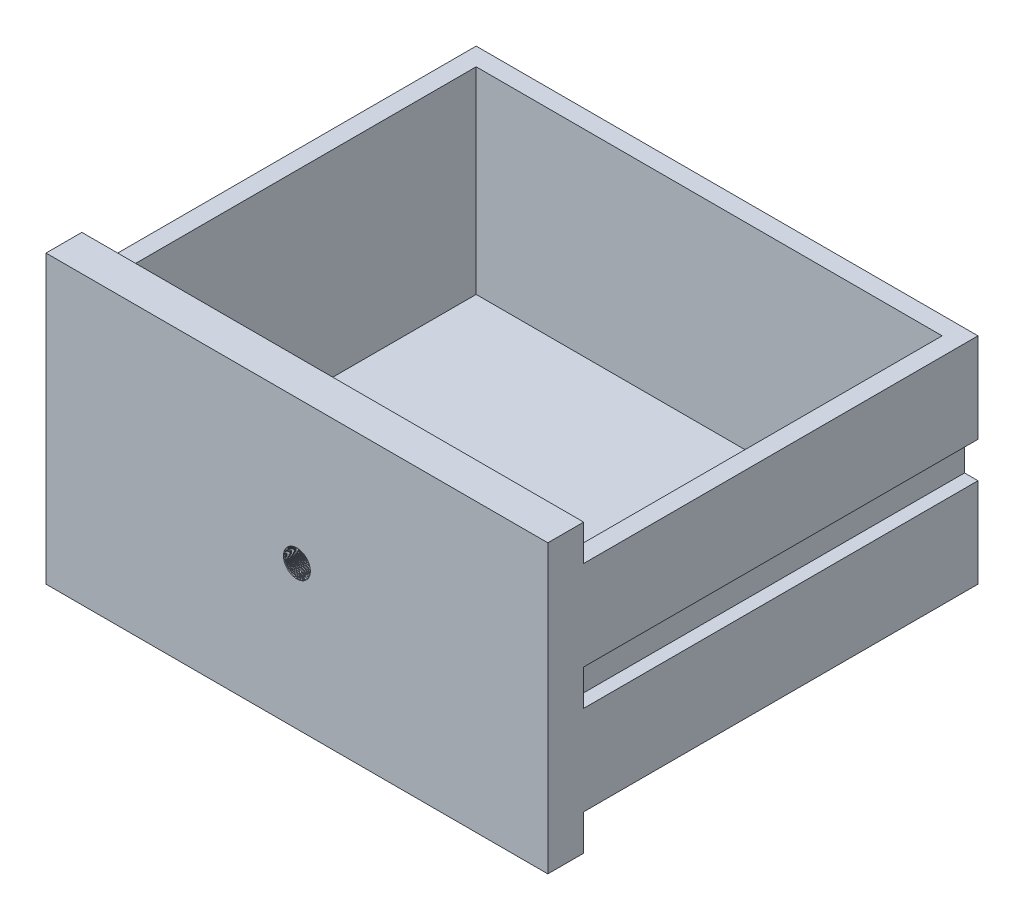
from build123d import *
from build123d.topology import SkipClean

# Parameters (mm, degrees)
SKETCH1_W           = 355.6
SKETCH1_H           = 203.2
BOSS_EXTRUDE1_DEPTH = 25.4
SKETCH2_W           = 355.6
SKETCH2_H           = 152.4
BOSS_EXTRUDE2_DEPTH = 279.4
SHELL1_START        = -63.5
SHELL1_OUTLINE_W    = 330.2
SHELL1_OUTLINE_H    = 279.4
SHELL1_DEPTH        = 139.7
SKETCH3_W           = 19.05
SKETCH3_H           = 25.4
CUT_EXTRUDE1_DEPTH  = 279.4
CUT_EXTRUDE2_REACH  = 369.204
SKETCH4_R           = 9.525
THREAD1_PITCH       = 0.79375
SCALE1_SCALE        = 0.75


# Read off the part's stored shape, not the designer's step: Shell1
with BuildPart() as part:
    # Sketch1 → Boss-Extrude1 (new body)
    with BuildSketch(Plane.XY):
        Rectangle(SKETCH1_W, SKETCH1_H)
    extrude(amount=-BOSS_EXTRUDE1_DEPTH)

    # Sketch2 → Boss-Extrude2 (add)
    with BuildSketch(Plane(origin=(0, 0, -25.4), x_dir=(-1, 0, 0), z_dir=(0, 0, -1))):
        Rectangle(SKETCH2_W, SKETCH2_H)
    extrude(amount=BOSS_EXTRUDE2_DEPTH)

    # Shell1 outline → Shell1 (cut)
    with BuildSketch(Plane(origin=(0, 0, 0), x_dir=(1, 0, 0), z_dir=(0, 1, 0)).offset(SHELL1_START)):
        with Locations((0, 152.4)):
            Rectangle(SHELL1_OUTLINE_W, SHELL1_OUTLINE_H)
    extrude(amount=SHELL1_DEPTH, mode=Mode.SUBTRACT)

    # Sketch3 → Cut-Extrude1 (cut)
    with BuildSketch(Plane(origin=(0, 0, -304.8), x_dir=(-1, 0, 0), z_dir=(0, 0, -1))):
        with Locations((-177.8, 0)):
            Rectangle(SKETCH3_W, SKETCH3_H)
        with Locations((177.8, 0)):
            Rectangle(SKETCH3_W, SKETCH3_H)
    extrude(amount=-CUT_EXTRUDE1_DEPTH, mode=Mode.SUBTRACT)

    # Sketch4 → Cut-Extrude2 (cut, up to next)
    with BuildSketch(Plane.XY, mode=Mode.PRIVATE) as cut_extrude2_sk1:
        Circle(SKETCH4_R)
    cut_extrude2_tool1 = extrude(cut_extrude2_sk1.sketch, amount=-CUT_EXTRUDE2_REACH, mode=Mode.PRIVATE) & part.part
    add(cut_extrude2_tool1.solids().sort_by_distance((0, 0, 0))[0], mode=Mode.SUBTRACT)

    # Thread1: the profile of Thread Profile1 profile screwed along a right-hand helix of 32 turns, 8 arcs to a turn; built about Z, then put on its axis
    with SkipClean():  # the faces are left unmerged after this step: merging them gives an invalid solid
        thread1_z = Axis((0, 0, 0), (0, 0, 1))
        thread1_corners = [(9.5253, 0, -0.000173), (9.5253, 0, 0.694704), (9.09537, 0, 0.446484), (9.09537, 0, 0.248047)]
        with BuildLine(mode=Mode.PRIVATE) as thread1_profile:
            Line(thread1_corners[0], thread1_corners[1])
            Line(thread1_corners[1], thread1_corners[2])
            Line(thread1_corners[2], thread1_corners[3])
            Line(thread1_corners[3], thread1_corners[0])
        thread1_cap = Face(thread1_profile.wire())
        thread1_turn_angles = [0, 22.5, 45, 67.5, 90, 112.5, 135, 157.5, 180, 202.5, 225, 247.5, 270, 292.5, 315, 337.5, 360]
        thread1_turn_weights = [1, 0.9238795325112867, 1, 0.9238795325112867, 1, 0.9238795325112867, 1, 0.9238795325112867, 1, 0.9238795325112867, 1, 0.9238795325112867, 1, 0.9238795325112867, 1, 0.9238795325112867, 1]
        thread1_turn_rails = [Edge.make_bspline([Vector(p[0], p[1], 0).rotate(thread1_z, thread1_turn_angles[k]) / thread1_turn_weights[k] + Vector(0, 0, p[2] + THREAD1_PITCH * thread1_turn_angles[k] / 360) for k in range(17)], [0, 0, 0, 1, 1, 2, 2, 3, 3, 4, 4, 5, 5, 6, 6, 7, 7, 8, 8, 8], 2, thread1_turn_weights) for p in thread1_corners]
        thread1_turn_sides = [Face.make_surface_from_curves(thread1_turn_rails[p[0]], thread1_turn_rails[p[1]]) for p in [(0, 1), (1, 2), (2, 3), (3, 0)]]
        thread1 = Plane(origin=(0, 0, 0), x_dir=(-1, 0, 0), z_dir=(0, 0, -1)) * Solid(Shell([*[p.moved(Location((0, 0, THREAD1_PITCH * i))) for i in range(32) for p in thread1_turn_sides], thread1_cap, thread1_cap.rotate(thread1_z, 11520).moved(Location((0, 0, THREAD1_PITCH * 11520 / 360)))]))
        add(thread1)


with BuildPart() as part_1:
    # Scale1: scaled about (1.9e-05, -20.718742, -135.859169)
    add(part.part.scale(SCALE1_SCALE).moved(Location((5e-06, -5.179685, -33.964792))))


solid = part_1.part
